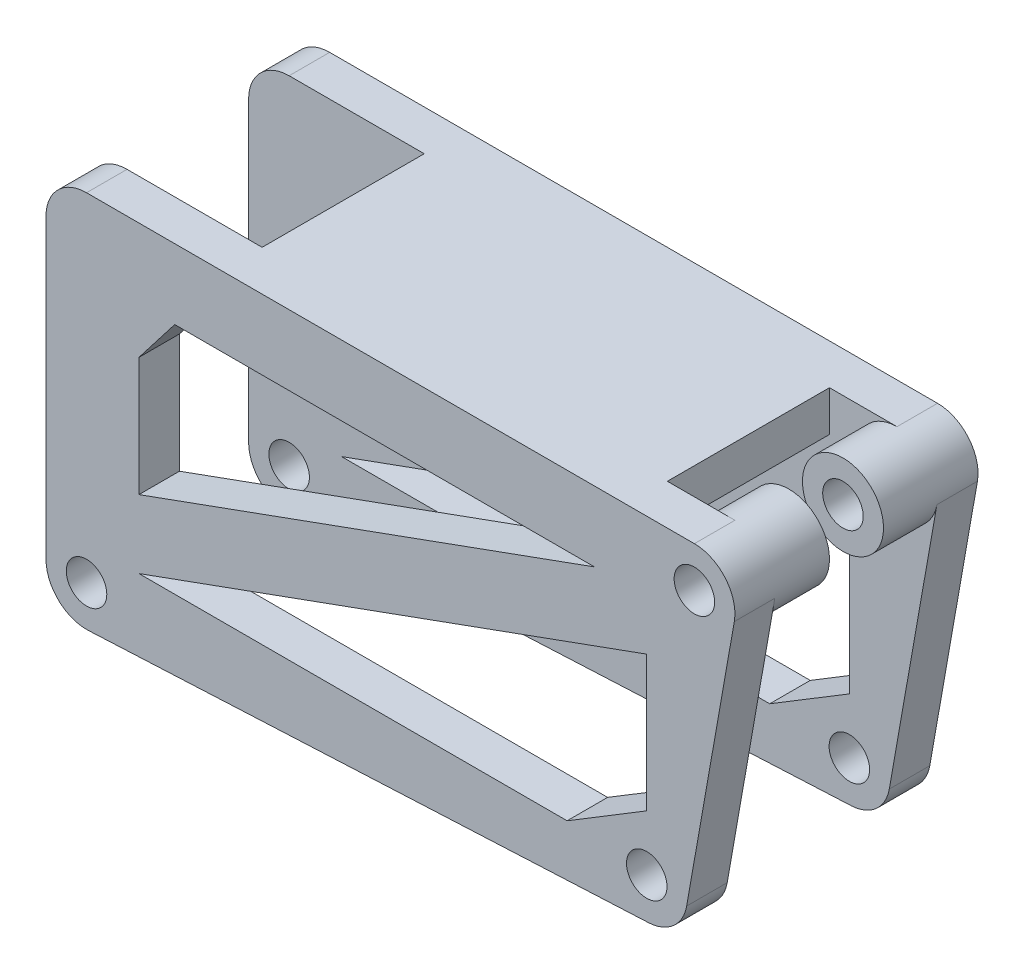
from build123d import *

# Parameters (mm, degrees)
SKETCH1_R           = 1.5
BOSS_EXTRUDE1_DEPTH = 3
LPATTERN1_COUNT     = 2
LPATTERN1_PITCH     = 15
SKETCH2_R           = 3
SKETCH2_R_2         = 1.5
BOSS_EXTRUDE2_DEPTH = 4
LPATTERN2_COUNT     = 2
LPATTERN2_PITCH     = 8
BOSS_EXTRUDE3_REACH = 58.16
SKETCH3_W           = 30
SKETCH3_H           = 3


with BuildPart() as part:
    # Sketch1 → Boss-Extrude1 (new body)
    with BuildSketch(Plane.XY):
        with BuildLine():
            Line((0, 3), (45, 3))
            ThreePointArc((45, 3), (47.298133329, 1.928362829), (47.954423259, -0.520944533))
            Line((47.954423259, -0.520944533), (44.427883645, -20.520944533))
            ThreePointArc((44.427883645, -20.520944533), (43.456627447, -22.25101053), (41.617963293, -22.996517797))
            Line((41.617963293, -22.996517797), (0.144502907, -24.996517797))
            ThreePointArc((0.144502907, -24.996517797), (-2.069600357, -24.171809006), (-3, -22))
            Line((-3, -22), (-3, 0))
            ThreePointArc((-3, 0), (-2.121320344, 2.121320344), (0, 3))
        make_face()
        with Locations((45, 0)):
            Circle(SKETCH1_R, mode=Mode.SUBTRACT)
        with Locations((41.473460386, -20)):
            Circle(SKETCH1_R, mode=Mode.SUBTRACT)
        with Locations((0, -22)):
            Circle(SKETCH1_R, mode=Mode.SUBTRACT)
        Polygon((3.881124623, -14.414030159), (3.881124623, -5.613630965), (6.529032345, -2.186926854), (37.60300826, -2.186926854), align=None, mode=Mode.SUBTRACT)
        Polygon((3.881124623, -19.476206686), (41.473460386, -5.845729285), (41.473460386, -15.893743297), (35.578137649, -19.476206686), align=None, mode=Mode.SUBTRACT)
    extrude(amount=BOSS_EXTRUDE1_DEPTH)


with BuildPart() as lpattern1_1:
    # LPattern1: pattern copy
    add(part.part.moved(Location(Vector(0, 0, 1) * (1 * LPATTERN1_PITCH))))


with BuildPart() as part_1:
    add(part.part)

    # Sketch2 → Boss-Extrude2 (add)
    with BuildSketch(Plane.XY.offset(3)):
        with Locations((45, 0)):
            Circle(SKETCH2_R)
        with Locations((45, 0)):
            Circle(SKETCH2_R_2, mode=Mode.SUBTRACT)
    boss_extrude2 = extrude(amount=BOSS_EXTRUDE2_DEPTH)


with BuildPart() as lpattern1_1_1:
    add(lpattern1_1.part)

    # LPattern2: Boss-Extrude2 ×2
    with Locations(*[(0, 0, i * LPATTERN2_PITCH) for i in range(1, LPATTERN2_COUNT)]):
        add(boss_extrude2)

    # Sketch3 → Boss-Extrude3 (add, up to next)
    with BuildSketch(Plane.XY.offset(3), mode=Mode.PRIVATE) as boss_extrude3_sk1:
        with Locations((25, 1.5)):
            Rectangle(SKETCH3_W, SKETCH3_H)
    boss_extrude3_tool1 = extrude(boss_extrude3_sk1.sketch, amount=BOSS_EXTRUDE3_REACH, mode=Mode.PRIVATE) - lpattern1_1_1.part

    add(part_1.part)  # Boss-Extrude3 merges part
    add(boss_extrude3_tool1.solids().sort_by_distance((25, 1.5, 3))[0])


solid = lpattern1_1_1.part
